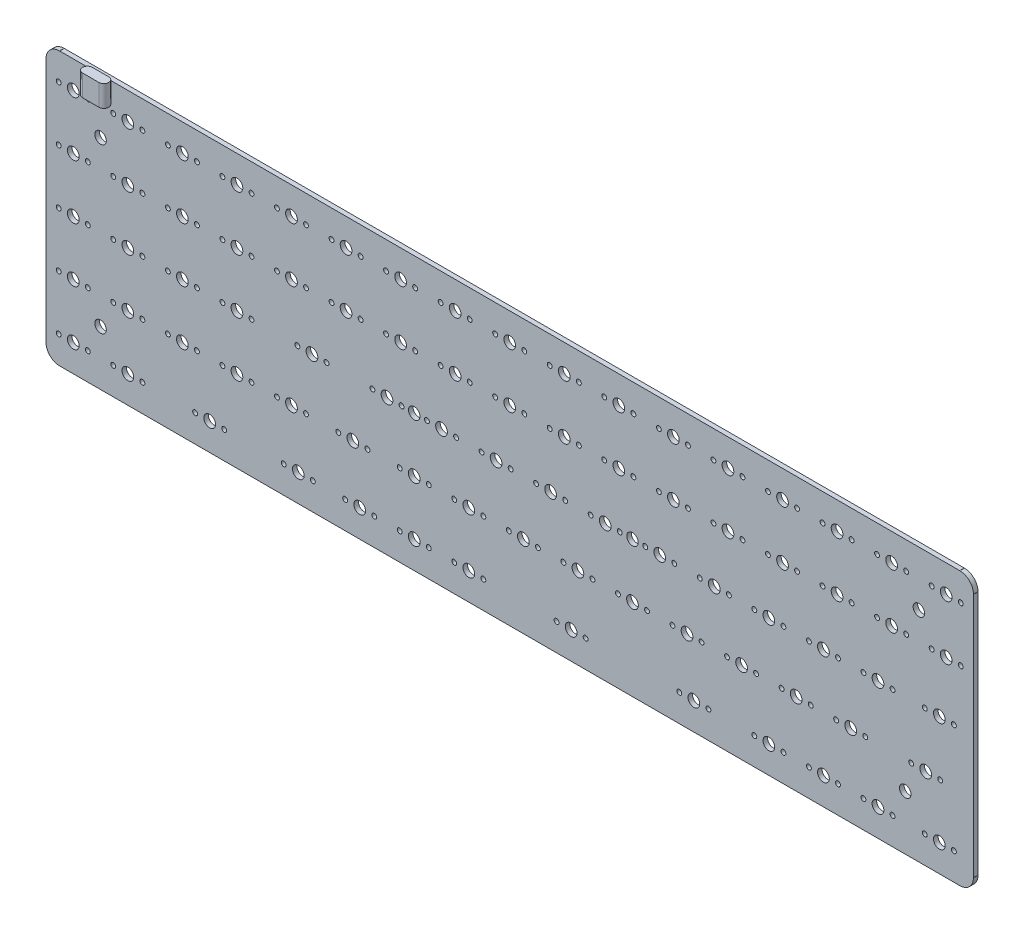
from build123d import *

# Parameters (mm, degrees)
SKETCH2_R                = 0.8534
SKETCH2_R_2              = 2.0447
SKETCH2_R_3              = 2
SKETCH2_R_4              = 0.325
BOSS_EXTRUDE3_DEPTH      = 0.79375
BOSS_EXTRUDE4_DEPTH      = 0.762
BOSS_EXTRUDE4_DEPTH_BACK = 6.731


with BuildPart() as part:
    # Sketch2 → Boss-Extrude3 (new, symmetric)
    with BuildSketch(Plane.XY):
        with BuildLine():
            ThreePointArc((314.2869, -4.7625), (314.298059232, -4.735559232), (314.325, -4.7244))
            Line((314.325, -4.7244), (314.325, 80.9244))
            ThreePointArc((314.325, 80.9244), (314.298059232, 80.935559232), (314.2869, 80.9625))
            ThreePointArc((314.2869, 80.9625), (314.298005094, 80.989386522), (314.324846721, 81.000599692))
            ThreePointArc((314.324846721, 81.000599692), (312.93006375, 84.33006375), (309.600599692, 85.724846721))
            ThreePointArc((309.600599692, 85.724846721), (309.589386522, 85.698005094), (309.5625, 85.6869))
            ThreePointArc((309.5625, 85.6869), (309.535559232, 85.698059232), (309.5244, 85.725))
            Line((309.5244, 85.725), (-4.7244, 85.725))
            ThreePointArc((-4.7244, 85.725), (-4.735559232, 85.698059232), (-4.7625, 85.6869))
            ThreePointArc((-4.7625, 85.6869), (-4.789386522, 85.698005094), (-4.800599692, 85.724846721))
            ThreePointArc((-4.800599692, 85.724846721), (-8.13006375, 84.33006375), (-9.524846721, 81.000599692))
            ThreePointArc((-9.524846721, 81.000599692), (-9.498005094, 80.989386522), (-9.4869, 80.9625))
            ThreePointArc((-9.4869, 80.9625), (-9.498059232, 80.935559232), (-9.525, 80.9244))
            Line((-9.525, 80.9244), (-9.525, -4.7244))
            ThreePointArc((-9.525, -4.7244), (-9.498059232, -4.735559232), (-9.4869, -4.7625))
            ThreePointArc((-9.4869, -4.7625), (-9.498005094, -4.789386522), (-9.524846721, -4.800599692))
            ThreePointArc((-9.524846721, -4.800599692), (-8.13006375, -8.13006375), (-4.800599692, -9.524846721))
            ThreePointArc((-4.800599692, -9.524846721), (-4.789386522, -9.498005094), (-4.7625, -9.4869))
            ThreePointArc((-4.7625, -9.4869), (-4.735559232, -9.498059232), (-4.7244, -9.525))
            Line((-4.7244, -9.525), (309.5244, -9.525))
            ThreePointArc((309.5244, -9.525), (309.535559232, -9.498059232), (309.5625, -9.4869))
            ThreePointArc((309.5625, -9.4869), (309.589386522, -9.498005094), (309.600599692, -9.524846721))
            ThreePointArc((309.600599692, -9.524846721), (312.93006375, -8.13006375), (314.324846721, -4.800599692))
            ThreePointArc((314.324846721, -4.800599692), (314.298005094, -4.789386522), (314.2869, -4.7625))
        make_face()
        with Locations((-5.08, 0)):
            Circle(SKETCH2_R, mode=Mode.SUBTRACT)
        Circle(SKETCH2_R_2, mode=Mode.SUBTRACT)
        with Locations((5.08, 0)):
            Circle(SKETCH2_R, mode=Mode.SUBTRACT)
        with Locations((13.97, 0)):
            Circle(SKETCH2_R, mode=Mode.SUBTRACT)
        with Locations((19.05, 0)):
            Circle(SKETCH2_R_2, mode=Mode.SUBTRACT)
        with Locations((24.13, 0)):
            Circle(SKETCH2_R, mode=Mode.SUBTRACT)
        with Locations((42.545, 0)):
            Circle(SKETCH2_R, mode=Mode.SUBTRACT)
        with Locations((47.625, 0)):
            Circle(SKETCH2_R_2, mode=Mode.SUBTRACT)
        with Locations((52.705, 0)):
            Circle(SKETCH2_R, mode=Mode.SUBTRACT)
        with Locations((9.525, 9.525)):
            Circle(SKETCH2_R_3, mode=Mode.SUBTRACT)
        with Locations((73.5012, 0)):
            Circle(SKETCH2_R, mode=Mode.SUBTRACT)
        with Locations((78.5812, 0)):
            Circle(SKETCH2_R_2, mode=Mode.SUBTRACT)
        with Locations((83.6613, 0)):
            Circle(SKETCH2_R, mode=Mode.SUBTRACT)
        with Locations((94.9325, 0)):
            Circle(SKETCH2_R, mode=Mode.SUBTRACT)
        with Locations((100.0125, 0)):
            Circle(SKETCH2_R_2, mode=Mode.SUBTRACT)
        with Locations((105.0925, 0)):
            Circle(SKETCH2_R, mode=Mode.SUBTRACT)
        with Locations((113.9825, 0)):
            Circle(SKETCH2_R, mode=Mode.SUBTRACT)
        with Locations((119.0625, 0)):
            Circle(SKETCH2_R_2, mode=Mode.SUBTRACT)
        with Locations((124.1425, 0)):
            Circle(SKETCH2_R, mode=Mode.SUBTRACT)
        with Locations((133.0325, 0)):
            Circle(SKETCH2_R, mode=Mode.SUBTRACT)
        with Locations((138.1125, 0)):
            Circle(SKETCH2_R_2, mode=Mode.SUBTRACT)
        with Locations((143.1925, 0)):
            Circle(SKETCH2_R, mode=Mode.SUBTRACT)
        with Locations((-5.08, 19.05)):
            Circle(SKETCH2_R, mode=Mode.SUBTRACT)
        with Locations((0, 19.05)):
            Circle(SKETCH2_R_2, mode=Mode.SUBTRACT)
        with Locations((5.08, 19.05)):
            Circle(SKETCH2_R, mode=Mode.SUBTRACT)
        with Locations((13.97, 19.05)):
            Circle(SKETCH2_R, mode=Mode.SUBTRACT)
        with Locations((19.05, 19.05)):
            Circle(SKETCH2_R_2, mode=Mode.SUBTRACT)
        with Locations((24.13, 19.05)):
            Circle(SKETCH2_R, mode=Mode.SUBTRACT)
        with Locations((33.02, 19.05)):
            Circle(SKETCH2_R, mode=Mode.SUBTRACT)
        with Locations((38.1, 19.05)):
            Circle(SKETCH2_R_2, mode=Mode.SUBTRACT)
        with Locations((43.18, 19.05)):
            Circle(SKETCH2_R, mode=Mode.SUBTRACT)
        with Locations((52.07, 19.05)):
            Circle(SKETCH2_R, mode=Mode.SUBTRACT)
        with Locations((57.15, 19.05)):
            Circle(SKETCH2_R_2, mode=Mode.SUBTRACT)
        with Locations((62.23, 19.05)):
            Circle(SKETCH2_R, mode=Mode.SUBTRACT)
        with Locations((71.12, 19.05)):
            Circle(SKETCH2_R, mode=Mode.SUBTRACT)
        with Locations((76.2, 19.05)):
            Circle(SKETCH2_R_2, mode=Mode.SUBTRACT)
        with Locations((81.28, 19.05)):
            Circle(SKETCH2_R, mode=Mode.SUBTRACT)
        with Locations((92.5513, 19.05)):
            Circle(SKETCH2_R, mode=Mode.SUBTRACT)
        with Locations((97.6313, 19.05)):
            Circle(SKETCH2_R_2, mode=Mode.SUBTRACT)
        with Locations((102.7113, 19.05)):
            Circle(SKETCH2_R, mode=Mode.SUBTRACT)
        with Locations((113.9825, 19.05)):
            Circle(SKETCH2_R, mode=Mode.SUBTRACT)
        with Locations((119.0625, 19.05)):
            Circle(SKETCH2_R_2, mode=Mode.SUBTRACT)
        with Locations((124.1425, 19.05)):
            Circle(SKETCH2_R, mode=Mode.SUBTRACT)
        with Locations((133.0325, 19.05)):
            Circle(SKETCH2_R, mode=Mode.SUBTRACT)
        with Locations((138.1125, 19.05)):
            Circle(SKETCH2_R_2, mode=Mode.SUBTRACT)
        with Locations((143.1925, 19.05)):
            Circle(SKETCH2_R, mode=Mode.SUBTRACT)
        with Locations((152.0825, 19.05)):
            Circle(SKETCH2_R, mode=Mode.SUBTRACT)
        with Locations((168.7512, 0)):
            Circle(SKETCH2_R, mode=Mode.SUBTRACT)
        with Locations((173.8313, 0)):
            Circle(SKETCH2_R_2, mode=Mode.SUBTRACT)
        with Locations((178.9112, 0)):
            Circle(SKETCH2_R, mode=Mode.SUBTRACT)
        with Locations((211.6138, 0)):
            Circle(SKETCH2_R, mode=Mode.SUBTRACT)
        with Locations((216.6938, 0)):
            Circle(SKETCH2_R_2, mode=Mode.SUBTRACT)
        with Locations((221.7738, 0)):
            Circle(SKETCH2_R, mode=Mode.SUBTRACT)
        with Locations((237.8075, 0)):
            Circle(SKETCH2_R, mode=Mode.SUBTRACT)
        with Locations((242.8875, 0)):
            Circle(SKETCH2_R_2, mode=Mode.SUBTRACT)
        with Locations((247.9675, 0)):
            Circle(SKETCH2_R, mode=Mode.SUBTRACT)
        with Locations((256.8575, 0)):
            Circle(SKETCH2_R, mode=Mode.SUBTRACT)
        with Locations((261.9375, 0)):
            Circle(SKETCH2_R_2, mode=Mode.SUBTRACT)
        with Locations((267.0175, 0)):
            Circle(SKETCH2_R, mode=Mode.SUBTRACT)
        with Locations((275.9075, 0)):
            Circle(SKETCH2_R, mode=Mode.SUBTRACT)
        with Locations((280.9875, 0)):
            Circle(SKETCH2_R_2, mode=Mode.SUBTRACT)
        with Locations((286.0675, 0)):
            Circle(SKETCH2_R, mode=Mode.SUBTRACT)
        with Locations((297.3388, 0)):
            Circle(SKETCH2_R, mode=Mode.SUBTRACT)
        with Locations((302.4187, 0)):
            Circle(SKETCH2_R_2, mode=Mode.SUBTRACT)
        with Locations((307.4988, 0)):
            Circle(SKETCH2_R, mode=Mode.SUBTRACT)
        with Locations((290.5125, 9.525)):
            Circle(SKETCH2_R_3, mode=Mode.SUBTRACT)
        with Locations((157.1625, 19.05)):
            Circle(SKETCH2_R_2, mode=Mode.SUBTRACT)
        with Locations((162.2425, 19.05)):
            Circle(SKETCH2_R, mode=Mode.SUBTRACT)
        with Locations((171.1325, 19.05)):
            Circle(SKETCH2_R, mode=Mode.SUBTRACT)
        with Locations((176.2125, 19.05)):
            Circle(SKETCH2_R_2, mode=Mode.SUBTRACT)
        with Locations((181.2925, 19.05)):
            Circle(SKETCH2_R, mode=Mode.SUBTRACT)
        with Locations((190.1825, 19.05)):
            Circle(SKETCH2_R, mode=Mode.SUBTRACT)
        with Locations((195.2625, 19.05)):
            Circle(SKETCH2_R_2, mode=Mode.SUBTRACT)
        with Locations((200.3425, 19.05)):
            Circle(SKETCH2_R, mode=Mode.SUBTRACT)
        with Locations((209.2325, 19.05)):
            Circle(SKETCH2_R, mode=Mode.SUBTRACT)
        with Locations((214.3125, 19.05)):
            Circle(SKETCH2_R_2, mode=Mode.SUBTRACT)
        with Locations((219.3925, 19.05)):
            Circle(SKETCH2_R, mode=Mode.SUBTRACT)
        with Locations((228.2825, 19.05)):
            Circle(SKETCH2_R, mode=Mode.SUBTRACT)
        with Locations((233.3625, 19.05)):
            Circle(SKETCH2_R_2, mode=Mode.SUBTRACT)
        with Locations((238.4425, 19.05)):
            Circle(SKETCH2_R, mode=Mode.SUBTRACT)
        with Locations((247.3325, 19.05)):
            Circle(SKETCH2_R, mode=Mode.SUBTRACT)
        with Locations((252.4125, 19.05)):
            Circle(SKETCH2_R_2, mode=Mode.SUBTRACT)
        with Locations((257.4925, 19.05)):
            Circle(SKETCH2_R, mode=Mode.SUBTRACT)
        with Locations((266.3825, 19.05)):
            Circle(SKETCH2_R, mode=Mode.SUBTRACT)
        with Locations((271.4625, 19.05)):
            Circle(SKETCH2_R_2, mode=Mode.SUBTRACT)
        with Locations((276.5425, 19.05)):
            Circle(SKETCH2_R, mode=Mode.SUBTRACT)
        with Locations((292.5763, 19.05)):
            Circle(SKETCH2_R, mode=Mode.SUBTRACT)
        with Locations((297.6563, 19.05)):
            Circle(SKETCH2_R_2, mode=Mode.SUBTRACT)
        with Locations((302.7363, 19.05)):
            Circle(SKETCH2_R, mode=Mode.SUBTRACT)
        with Locations((-5.08, 38.1)):
            Circle(SKETCH2_R, mode=Mode.SUBTRACT)
        with Locations((0, 38.1)):
            Circle(SKETCH2_R_2, mode=Mode.SUBTRACT)
        with Locations((5.08, 38.1)):
            Circle(SKETCH2_R, mode=Mode.SUBTRACT)
        with Locations((13.97, 38.1)):
            Circle(SKETCH2_R, mode=Mode.SUBTRACT)
        with Locations((19.05, 38.1)):
            Circle(SKETCH2_R_2, mode=Mode.SUBTRACT)
        with Locations((24.13, 38.1)):
            Circle(SKETCH2_R, mode=Mode.SUBTRACT)
        with Locations((33.02, 38.1)):
            Circle(SKETCH2_R, mode=Mode.SUBTRACT)
        with Locations((38.1, 38.1)):
            Circle(SKETCH2_R_2, mode=Mode.SUBTRACT)
        with Locations((43.18, 38.1)):
            Circle(SKETCH2_R, mode=Mode.SUBTRACT)
        with Locations((52.07, 38.1)):
            Circle(SKETCH2_R, mode=Mode.SUBTRACT)
        with Locations((57.15, 38.1)):
            Circle(SKETCH2_R_2, mode=Mode.SUBTRACT)
        with Locations((62.23, 38.1)):
            Circle(SKETCH2_R, mode=Mode.SUBTRACT)
        with Locations((-5.08, 57.15)):
            Circle(SKETCH2_R, mode=Mode.SUBTRACT)
        with Locations((0, 57.15)):
            Circle(SKETCH2_R_2, mode=Mode.SUBTRACT)
        with Locations((5.08, 57.15)):
            Circle(SKETCH2_R, mode=Mode.SUBTRACT)
        with Locations((13.97, 57.15)):
            Circle(SKETCH2_R, mode=Mode.SUBTRACT)
        with Locations((19.05, 57.15)):
            Circle(SKETCH2_R_2, mode=Mode.SUBTRACT)
        with Locations((24.13, 57.15)):
            Circle(SKETCH2_R, mode=Mode.SUBTRACT)
        with Locations((33.02, 57.15)):
            Circle(SKETCH2_R, mode=Mode.SUBTRACT)
        with Locations((38.1, 57.15)):
            Circle(SKETCH2_R_2, mode=Mode.SUBTRACT)
        with Locations((43.18, 57.15)):
            Circle(SKETCH2_R, mode=Mode.SUBTRACT)
        with Locations((52.07, 57.15)):
            Circle(SKETCH2_R, mode=Mode.SUBTRACT)
        with Locations((57.15, 57.15)):
            Circle(SKETCH2_R_2, mode=Mode.SUBTRACT)
        with Locations((62.23, 57.15)):
            Circle(SKETCH2_R, mode=Mode.SUBTRACT)
        with Locations((71.12, 57.15)):
            Circle(SKETCH2_R, mode=Mode.SUBTRACT)
        with Locations((78.2638, 38.1)):
            Circle(SKETCH2_R, mode=Mode.SUBTRACT)
        with Locations((83.3438, 38.1)):
            Circle(SKETCH2_R_2, mode=Mode.SUBTRACT)
        with Locations((88.4237, 38.1)):
            Circle(SKETCH2_R, mode=Mode.SUBTRACT)
        with Locations((104.4575, 38.1)):
            Circle(SKETCH2_R, mode=Mode.SUBTRACT)
        with Locations((109.5375, 38.1)):
            Circle(SKETCH2_R_2, mode=Mode.SUBTRACT)
        with Locations((114.6175, 38.1)):
            Circle(SKETCH2_R, mode=Mode.SUBTRACT)
        with Locations((119.0625, 38.1)):
            Circle(SKETCH2_R_3, mode=Mode.SUBTRACT)
        with Locations((123.5075, 38.1)):
            Circle(SKETCH2_R, mode=Mode.SUBTRACT)
        with Locations((128.5875, 38.1)):
            Circle(SKETCH2_R_2, mode=Mode.SUBTRACT)
        with Locations((133.6675, 38.1)):
            Circle(SKETCH2_R, mode=Mode.SUBTRACT)
        with Locations((142.5575, 38.1)):
            Circle(SKETCH2_R, mode=Mode.SUBTRACT)
        with Locations((147.6375, 38.1)):
            Circle(SKETCH2_R_2, mode=Mode.SUBTRACT)
        with Locations((76.2, 57.15)):
            Circle(SKETCH2_R_2, mode=Mode.SUBTRACT)
        with Locations((81.28, 57.15)):
            Circle(SKETCH2_R, mode=Mode.SUBTRACT)
        with Locations((90.17, 57.15)):
            Circle(SKETCH2_R, mode=Mode.SUBTRACT)
        with Locations((95.25, 57.15)):
            Circle(SKETCH2_R_2, mode=Mode.SUBTRACT)
        with Locations((100.33, 57.15)):
            Circle(SKETCH2_R, mode=Mode.SUBTRACT)
        with Locations((109.22, 57.15)):
            Circle(SKETCH2_R, mode=Mode.SUBTRACT)
        with Locations((114.3, 57.15)):
            Circle(SKETCH2_R_2, mode=Mode.SUBTRACT)
        with Locations((119.38, 57.15)):
            Circle(SKETCH2_R, mode=Mode.SUBTRACT)
        with Locations((128.27, 57.15)):
            Circle(SKETCH2_R, mode=Mode.SUBTRACT)
        with Locations((133.35, 57.15)):
            Circle(SKETCH2_R_2, mode=Mode.SUBTRACT)
        with Locations((138.43, 57.15)):
            Circle(SKETCH2_R, mode=Mode.SUBTRACT)
        with Locations((147.32, 57.15)):
            Circle(SKETCH2_R, mode=Mode.SUBTRACT)
        with Locations((9.525, 66.675)):
            Circle(SKETCH2_R_3, mode=Mode.SUBTRACT)
        with Locations((-5.08, 76.2)):
            Circle(SKETCH2_R, mode=Mode.SUBTRACT)
        with Locations((0, 76.2)):
            Circle(SKETCH2_R_2, mode=Mode.SUBTRACT)
        with Locations((5.08, 76.2)):
            Circle(SKETCH2_R, mode=Mode.SUBTRACT)
        with Locations((13.97, 76.2)):
            Circle(SKETCH2_R, mode=Mode.SUBTRACT)
        with Locations((19.05, 76.2)):
            Circle(SKETCH2_R_2, mode=Mode.SUBTRACT)
        with Locations((24.13, 76.2)):
            Circle(SKETCH2_R, mode=Mode.SUBTRACT)
        with Locations((6.635, 80.6463)):
            Circle(SKETCH2_R_4, mode=Mode.SUBTRACT)
        with Locations((12.415, 80.6463)):
            Circle(SKETCH2_R_4, mode=Mode.SUBTRACT)
        with Locations((33.02, 76.2)):
            Circle(SKETCH2_R, mode=Mode.SUBTRACT)
        with Locations((38.1, 76.2)):
            Circle(SKETCH2_R_2, mode=Mode.SUBTRACT)
        with Locations((43.18, 76.2)):
            Circle(SKETCH2_R, mode=Mode.SUBTRACT)
        with Locations((52.07, 76.2)):
            Circle(SKETCH2_R, mode=Mode.SUBTRACT)
        with Locations((57.15, 76.2)):
            Circle(SKETCH2_R_2, mode=Mode.SUBTRACT)
        with Locations((62.23, 76.2)):
            Circle(SKETCH2_R, mode=Mode.SUBTRACT)
        with Locations((71.12, 76.2)):
            Circle(SKETCH2_R, mode=Mode.SUBTRACT)
        with Locations((76.2, 76.2)):
            Circle(SKETCH2_R_2, mode=Mode.SUBTRACT)
        with Locations((81.28, 76.2)):
            Circle(SKETCH2_R, mode=Mode.SUBTRACT)
        with Locations((90.17, 76.2)):
            Circle(SKETCH2_R, mode=Mode.SUBTRACT)
        with Locations((95.25, 76.2)):
            Circle(SKETCH2_R_2, mode=Mode.SUBTRACT)
        with Locations((100.33, 76.2)):
            Circle(SKETCH2_R, mode=Mode.SUBTRACT)
        with Locations((109.22, 76.2)):
            Circle(SKETCH2_R, mode=Mode.SUBTRACT)
        with Locations((114.3, 76.2)):
            Circle(SKETCH2_R_2, mode=Mode.SUBTRACT)
        with Locations((119.38, 76.2)):
            Circle(SKETCH2_R, mode=Mode.SUBTRACT)
        with Locations((128.27, 76.2)):
            Circle(SKETCH2_R, mode=Mode.SUBTRACT)
        with Locations((133.35, 76.2)):
            Circle(SKETCH2_R_2, mode=Mode.SUBTRACT)
        with Locations((138.43, 76.2)):
            Circle(SKETCH2_R, mode=Mode.SUBTRACT)
        with Locations((147.32, 76.2)):
            Circle(SKETCH2_R, mode=Mode.SUBTRACT)
        with Locations((152.7175, 38.1)):
            Circle(SKETCH2_R, mode=Mode.SUBTRACT)
        with Locations((161.6075, 38.1)):
            Circle(SKETCH2_R, mode=Mode.SUBTRACT)
        with Locations((166.6875, 38.1)):
            Circle(SKETCH2_R_2, mode=Mode.SUBTRACT)
        with Locations((171.7675, 38.1)):
            Circle(SKETCH2_R, mode=Mode.SUBTRACT)
        with Locations((180.6575, 38.1)):
            Circle(SKETCH2_R, mode=Mode.SUBTRACT)
        with Locations((185.7375, 38.1)):
            Circle(SKETCH2_R_2, mode=Mode.SUBTRACT)
        with Locations((190.8175, 38.1)):
            Circle(SKETCH2_R, mode=Mode.SUBTRACT)
        with Locations((195.2625, 38.1)):
            Circle(SKETCH2_R_3, mode=Mode.SUBTRACT)
        with Locations((199.7075, 38.1)):
            Circle(SKETCH2_R, mode=Mode.SUBTRACT)
        with Locations((204.7875, 38.1)):
            Circle(SKETCH2_R_2, mode=Mode.SUBTRACT)
        with Locations((209.8675, 38.1)):
            Circle(SKETCH2_R, mode=Mode.SUBTRACT)
        with Locations((218.7575, 38.1)):
            Circle(SKETCH2_R, mode=Mode.SUBTRACT)
        with Locations((223.8375, 38.1)):
            Circle(SKETCH2_R_2, mode=Mode.SUBTRACT)
        with Locations((228.9175, 38.1)):
            Circle(SKETCH2_R, mode=Mode.SUBTRACT)
        with Locations((152.4, 57.15)):
            Circle(SKETCH2_R_2, mode=Mode.SUBTRACT)
        with Locations((157.48, 57.15)):
            Circle(SKETCH2_R, mode=Mode.SUBTRACT)
        with Locations((166.37, 57.15)):
            Circle(SKETCH2_R, mode=Mode.SUBTRACT)
        with Locations((171.45, 57.15)):
            Circle(SKETCH2_R_2, mode=Mode.SUBTRACT)
        with Locations((176.53, 57.15)):
            Circle(SKETCH2_R, mode=Mode.SUBTRACT)
        with Locations((185.42, 57.15)):
            Circle(SKETCH2_R, mode=Mode.SUBTRACT)
        with Locations((190.5, 57.15)):
            Circle(SKETCH2_R_2, mode=Mode.SUBTRACT)
        with Locations((195.58, 57.15)):
            Circle(SKETCH2_R, mode=Mode.SUBTRACT)
        with Locations((204.47, 57.15)):
            Circle(SKETCH2_R, mode=Mode.SUBTRACT)
        with Locations((209.55, 57.15)):
            Circle(SKETCH2_R_2, mode=Mode.SUBTRACT)
        with Locations((214.63, 57.15)):
            Circle(SKETCH2_R, mode=Mode.SUBTRACT)
        with Locations((223.52, 57.15)):
            Circle(SKETCH2_R, mode=Mode.SUBTRACT)
        with Locations((228.6, 57.15)):
            Circle(SKETCH2_R_2, mode=Mode.SUBTRACT)
        with Locations((237.8075, 38.1)):
            Circle(SKETCH2_R, mode=Mode.SUBTRACT)
        with Locations((242.8875, 38.1)):
            Circle(SKETCH2_R_2, mode=Mode.SUBTRACT)
        with Locations((247.9675, 38.1)):
            Circle(SKETCH2_R, mode=Mode.SUBTRACT)
        with Locations((256.8575, 38.1)):
            Circle(SKETCH2_R, mode=Mode.SUBTRACT)
        with Locations((261.9375, 38.1)):
            Circle(SKETCH2_R_2, mode=Mode.SUBTRACT)
        with Locations((267.0175, 38.1)):
            Circle(SKETCH2_R, mode=Mode.SUBTRACT)
        with Locations((275.9075, 38.1)):
            Circle(SKETCH2_R, mode=Mode.SUBTRACT)
        with Locations((280.9875, 38.1)):
            Circle(SKETCH2_R_2, mode=Mode.SUBTRACT)
        with Locations((286.0675, 38.1)):
            Circle(SKETCH2_R, mode=Mode.SUBTRACT)
        with Locations((297.3388, 38.1)):
            Circle(SKETCH2_R, mode=Mode.SUBTRACT)
        with Locations((302.4187, 38.1)):
            Circle(SKETCH2_R_2, mode=Mode.SUBTRACT)
        with Locations((307.4988, 38.1)):
            Circle(SKETCH2_R, mode=Mode.SUBTRACT)
        with Locations((233.68, 57.15)):
            Circle(SKETCH2_R, mode=Mode.SUBTRACT)
        with Locations((242.57, 57.15)):
            Circle(SKETCH2_R, mode=Mode.SUBTRACT)
        with Locations((247.65, 57.15)):
            Circle(SKETCH2_R_2, mode=Mode.SUBTRACT)
        with Locations((252.73, 57.15)):
            Circle(SKETCH2_R, mode=Mode.SUBTRACT)
        with Locations((261.62, 57.15)):
            Circle(SKETCH2_R, mode=Mode.SUBTRACT)
        with Locations((266.7, 57.15)):
            Circle(SKETCH2_R_2, mode=Mode.SUBTRACT)
        with Locations((271.78, 57.15)):
            Circle(SKETCH2_R, mode=Mode.SUBTRACT)
        with Locations((280.67, 57.15)):
            Circle(SKETCH2_R, mode=Mode.SUBTRACT)
        with Locations((285.75, 57.15)):
            Circle(SKETCH2_R_2, mode=Mode.SUBTRACT)
        with Locations((290.83, 57.15)):
            Circle(SKETCH2_R, mode=Mode.SUBTRACT)
        with Locations((299.72, 57.15)):
            Circle(SKETCH2_R, mode=Mode.SUBTRACT)
        with Locations((304.8, 57.15)):
            Circle(SKETCH2_R_2, mode=Mode.SUBTRACT)
        with Locations((309.88, 57.15)):
            Circle(SKETCH2_R, mode=Mode.SUBTRACT)
        with Locations((152.4, 76.2)):
            Circle(SKETCH2_R_2, mode=Mode.SUBTRACT)
        with Locations((157.48, 76.2)):
            Circle(SKETCH2_R, mode=Mode.SUBTRACT)
        with Locations((166.37, 76.2)):
            Circle(SKETCH2_R, mode=Mode.SUBTRACT)
        with Locations((171.45, 76.2)):
            Circle(SKETCH2_R_2, mode=Mode.SUBTRACT)
        with Locations((176.53, 76.2)):
            Circle(SKETCH2_R, mode=Mode.SUBTRACT)
        with Locations((185.42, 76.2)):
            Circle(SKETCH2_R, mode=Mode.SUBTRACT)
        with Locations((190.5, 76.2)):
            Circle(SKETCH2_R_2, mode=Mode.SUBTRACT)
        with Locations((195.58, 76.2)):
            Circle(SKETCH2_R, mode=Mode.SUBTRACT)
        with Locations((204.47, 76.2)):
            Circle(SKETCH2_R, mode=Mode.SUBTRACT)
        with Locations((209.55, 76.2)):
            Circle(SKETCH2_R_2, mode=Mode.SUBTRACT)
        with Locations((214.63, 76.2)):
            Circle(SKETCH2_R, mode=Mode.SUBTRACT)
        with Locations((223.52, 76.2)):
            Circle(SKETCH2_R, mode=Mode.SUBTRACT)
        with Locations((228.6, 76.2)):
            Circle(SKETCH2_R_2, mode=Mode.SUBTRACT)
        with Locations((295.275, 66.675)):
            Circle(SKETCH2_R_3, mode=Mode.SUBTRACT)
        with Locations((233.68, 76.2)):
            Circle(SKETCH2_R, mode=Mode.SUBTRACT)
        with Locations((242.57, 76.2)):
            Circle(SKETCH2_R, mode=Mode.SUBTRACT)
        with Locations((247.65, 76.2)):
            Circle(SKETCH2_R_2, mode=Mode.SUBTRACT)
        with Locations((252.73, 76.2)):
            Circle(SKETCH2_R, mode=Mode.SUBTRACT)
        with Locations((261.62, 76.2)):
            Circle(SKETCH2_R, mode=Mode.SUBTRACT)
        with Locations((266.7, 76.2)):
            Circle(SKETCH2_R_2, mode=Mode.SUBTRACT)
        with Locations((271.78, 76.2)):
            Circle(SKETCH2_R, mode=Mode.SUBTRACT)
        with Locations((280.67, 76.2)):
            Circle(SKETCH2_R, mode=Mode.SUBTRACT)
        with Locations((285.75, 76.2)):
            Circle(SKETCH2_R_2, mode=Mode.SUBTRACT)
        with Locations((290.83, 76.2)):
            Circle(SKETCH2_R, mode=Mode.SUBTRACT)
        with Locations((299.72, 76.2)):
            Circle(SKETCH2_R, mode=Mode.SUBTRACT)
        with Locations((304.8, 76.2)):
            Circle(SKETCH2_R_2, mode=Mode.SUBTRACT)
        with Locations((309.88, 76.2)):
            Circle(SKETCH2_R, mode=Mode.SUBTRACT)
    extrude(amount=BOSS_EXTRUDE3_DEPTH, both=True)

    # Sketch3 → Boss-Extrude4 (add, two sides: drawn at the far end of the back side and taken through both)
    with BuildSketch(Plane(origin=(0, 85.725, 0), x_dir=(1, 0, 0), z_dir=(0, 1, 0)).offset(-BOSS_EXTRUDE4_DEPTH_BACK)):
        with BuildLine():
            Line((12.3825, -4.22275), (6.6675, -4.22275))
            ThreePointArc((6.6675, -4.22275), (4.953, -2.50825), (6.6675, -0.79375))
            Line((6.6675, -0.79375), (12.3825, -0.79375))
            ThreePointArc((12.3825, -0.79375), (14.097, -2.50825), (12.3825, -4.22275))
        make_face()
    extrude(amount=BOSS_EXTRUDE4_DEPTH + BOSS_EXTRUDE4_DEPTH_BACK)


solid = part.part
